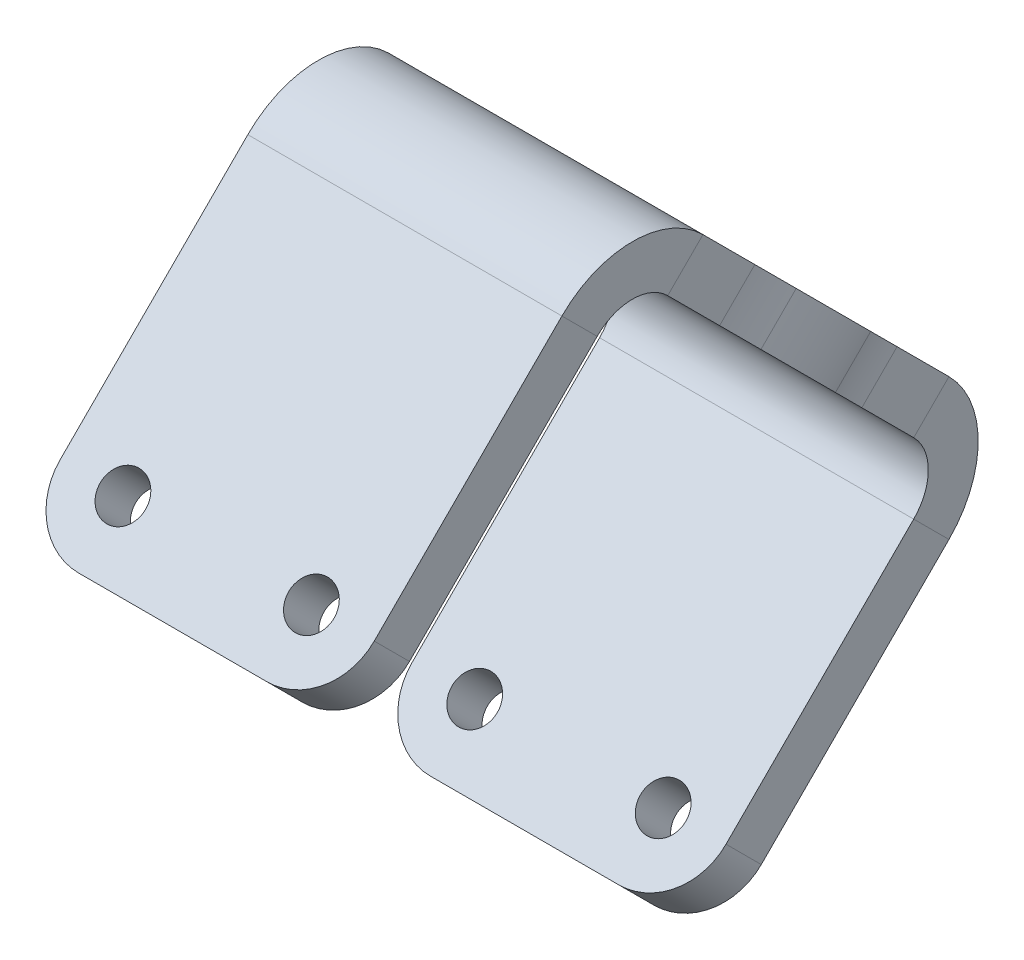
from build123d import *

# Parameters (mm, degrees)
BASE_FLANGE2_DEPTH      = 10
BASE_FLANGE2_DEPTH_BACK = 10
TAB1_DEPTH              = 3.175
FILLET2_R               = 10
M2_5_CLEARANCE_HOLE1_D  = 2.9
FILLET1_R               = 4
M2_CLEARANCE_HOLE2_D    = 2.4
SKETCH24_R              = 4.5
CUT_EXTRUDE1_DEPTH      = 10


# Sheet-metal steps are written as plain solids
with BuildPart() as part:
    # Sketch9 → Base-Flange2 (new, two sides: drawn at the far end of the back side and taken through both)
    with BuildSketch(Plane(origin=(0, 0, 0), x_dir=(0, 0, -1), z_dir=(1, 0, 0)).offset(-BASE_FLANGE2_DEPTH_BACK)):
        with BuildLine():
            Line((-346.659099477, 27.04683438), (-331.88056775, 41.825366107))
            ThreePointArc((-331.88056775, 41.825366107), (-329.63550372, 42.755302077), (-327.390439689, 41.825366107))
            Line((-327.390439689, 41.825366107), (-311.728024486, 26.162950904))
            ThreePointArc((-311.728024486, 26.162950904), (-310.798088516, 23.917886874), (-311.728024486, 21.672822843))
            Line((-311.728024486, 21.672822843), (-326.506556213, 6.894291117))
            Line((-326.506556213, 6.894291117), (-324.261492183, 4.649227086))
            Line((-324.261492183, 4.649227086), (-309.482960456, 19.427758813))
            ThreePointArc((-309.482960456, 19.427758813), (-307.623088516, 23.917886874), (-309.482960456, 28.408014934))
            Line((-309.482960456, 28.408014934), (-325.145375659, 44.070430137))
            ThreePointArc((-325.145375659, 44.070430137), (-329.63550372, 45.930302077), (-334.12563178, 44.070430137))
            Line((-334.12563178, 44.070430137), (-348.904163507, 29.291898411))
            Line((-348.904163507, 29.291898411), (-346.659099477, 27.04683438))
        make_face()
    extrude(amount=BASE_FLANGE2_DEPTH + BASE_FLANGE2_DEPTH_BACK)

    # Sketch25 → Tab1 (add)
    with BuildSketch(Plane(origin=(0, -142.782536791, 142.782536791), x_dir=(1, 0, 0), z_dir=(0, -0.7071067811865472, 0.7071067811865479))):
        with BuildLine():
            Line((-10, 254.582575695), (10, 254.582575695))
            ThreePointArc((10, 254.582575695), (11, 250), (10, 245.417424305))
            Line((10, 245.417424305), (-10, 245.417424305))
            ThreePointArc((-10, 245.417424305), (-11, 250), (-10, 254.582575695))
        make_face()
    extrude(amount=-TAB1_DEPTH)

    # Fillet2
    fillet2_edges = [part.edges().sort_by_distance(p)[0] for p in [
        (-10, 31.876320171, 315.196329723),
        (-10, 38.35706087, 321.677070422),
        (10, 38.35706087, 321.677070422),
        (10, 31.876320171, 315.196329723),
    ]]
    fillet(fillet2_edges, radius=FILLET2_R)

    # M2.5 Clearance Hole1 (through all)
    with Locations(Plane(origin=(0, 189.098030959, 189.098030959), x_dir=(1, 0, 0), z_dir=(0, 0.7071067811865477, 0.7071067811865475))):
        with Locations((-6, -222), (6, -222)):
            Hole(M2_5_CLEARANCE_HOLE1_D / 2)

    # Fillet1
    fillet1_edges = [part.edges().sort_by_distance(p)[0] for p in [
        (-10, 28.169366396, 347.781631492),
        (10, 28.169366396, 347.781631492),
        (-10, 5.771759101, 325.384024198),
        (10, 5.771759101, 325.384024198),
    ]]
    fillet(fillet1_edges, radius=FILLET1_R)

    # M2 Clearance Hole2 (through all)
    with Locations(Plane(origin=(0, -142.782536791, 142.782536791), x_dir=(1, 0, 0), z_dir=(0, -0.7071067811865472, 0.7071067811865479))):
        with Locations((0, 258), (5.656854249, 255.656854249), (8, 250), (5.656854249, 244.343145751), (0, 242), (-5.656854249, 244.343145751), (-8, 250), (-5.656854249, 255.656854249)):
            Hole(M2_CLEARANCE_HOLE2_D / 2)

    # Sketch24 → Cut-Extrude1 (cut)
    with BuildSketch(Plane(origin=(0, -142.782536791, 142.782536791), x_dir=(1, 0, 0), z_dir=(0, -0.7071067811865472, 0.7071067811865479))):
        with Locations(Location((0, 250, 0), (0, 0, 270))):
            Circle(SKETCH24_R)
    extrude(amount=-CUT_EXTRUDE1_DEPTH, mode=Mode.SUBTRACT)


solid = part.part
